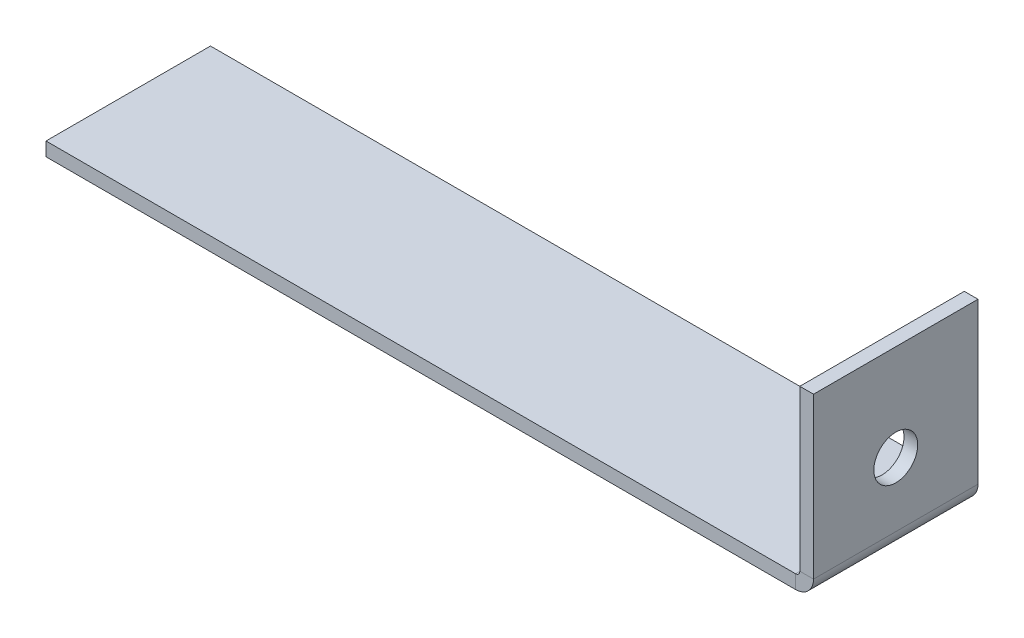
from build123d import *

# Parameters (mm, degrees)
SKETCH2_W                    = 177.8
SKETCH2_H                    = 38.1
BASE_FLANGE1_DEPTH           = 3.175
EDGE_FLANGE1_STRIP_W         = 14.7
EDGE_FLANGE1_STRIP_H         = 3.175
EDGE_FLANGE1_STRIP_CUT_DEPTH = 38.1
EDGE_FLANGE1_DEPTH           = 38.1
CUT_EXTRUDE1_REACH           = 184.749
SKETCH10_R                   = 5.08


# Sheet-metal steps are written as plain solids
with BuildPart() as part:
    # Sketch2 → Base-Flange1 (new body)
    with BuildSketch(Plane(origin=(0, 0, 0), x_dir=(1, 0, 0), z_dir=(0, 1, 0))):
        with Locations((88.9, 19.05)):
            Rectangle(SKETCH2_W, SKETCH2_H)
    extrude(amount=-BASE_FLANGE1_DEPTH)

    # Edge-Flange1 strip (across the edge) → Edge-Flange1 strip cut (cut)
    with BuildSketch(Plane(origin=(177.8, 0, 0), x_dir=(-1, 0, 0), z_dir=(0, 0, -1))):
        with Locations((-3.175, -1.5875)):
            Rectangle(EDGE_FLANGE1_STRIP_W, EDGE_FLANGE1_STRIP_H)
    extrude(amount=EDGE_FLANGE1_STRIP_CUT_DEPTH, mode=Mode.SUBTRACT)

    # Edge-Flange1 section (across the edge) → Edge-Flange1 (add)
    with BuildSketch(Plane(origin=(177.8, 0, 0), x_dir=(-1, 0, 0), z_dir=(0, 0, -1))):
        with BuildLine():
            Line((0, 1), (0, 38.1))
            Line((0, 38.1), (3.175, 38.1))
            Line((3.175, 38.1), (3.175, 1))
            ThreePointArc((3.175, 1), (3.467893219, 0.292893219), (4.175, 0))
            Line((4.175, 0), (4.175, -3.175))
            ThreePointArc((4.175, -3.175), (1.222829189, -1.952170811), (0, 1))
        make_face()
    extrude(amount=EDGE_FLANGE1_DEPTH)

    # Sketch10 → Cut-Extrude1 (cut, up to next)
    with BuildSketch(Plane.ZY.offset(-174.625), mode=Mode.PRIVATE) as cut_extrude1_sk1:
        with Locations(Location((-19.05, 15.875, 0), (0, 0, 270))):
            Circle(SKETCH10_R)
    cut_extrude1_tool1 = extrude(cut_extrude1_sk1.sketch, amount=-CUT_EXTRUDE1_REACH, mode=Mode.PRIVATE) & part.part
    add(cut_extrude1_tool1.solids().sort_by_distance((174.625, 15.875, -19.05))[0], mode=Mode.SUBTRACT)


solid = part.part
